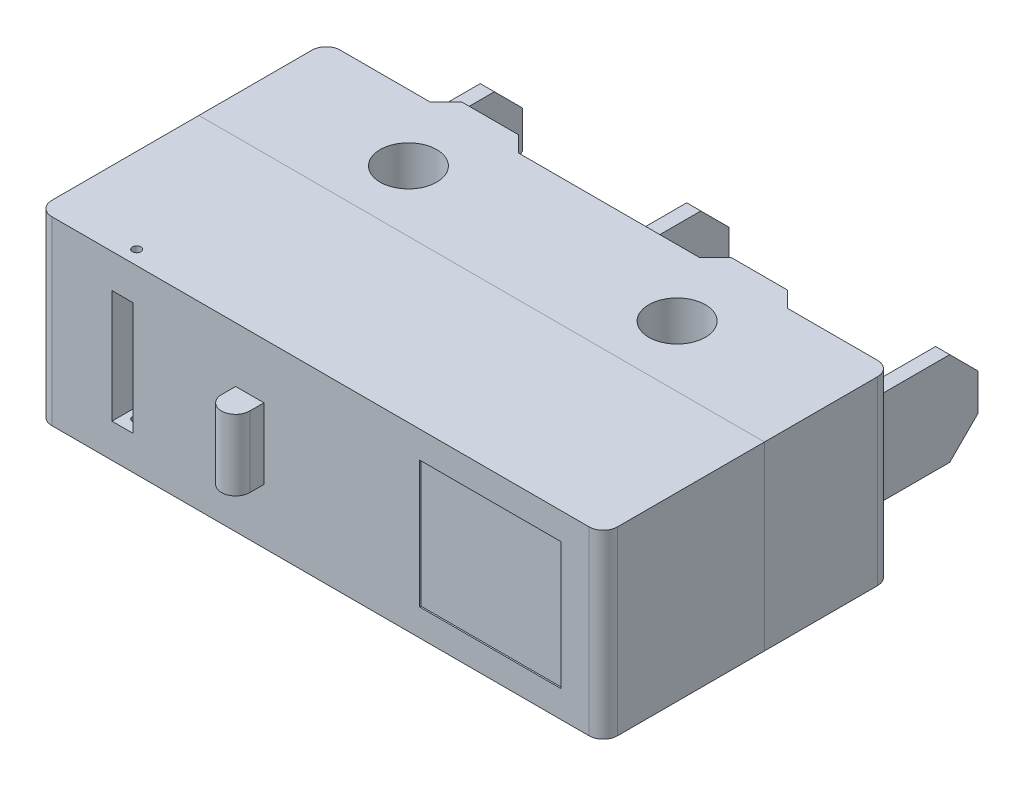
from build123d import *

# Parameters (mm, degrees)
BASE_SKETCH_W               = 20
BASE_SKETCH_H               = 6.4
BASE_EXTRUDE_DEPTH          = 4.5
CONTACTS_SKETCH_W           = 0.5
CONTACTS_SKETCH_H           = 3.3
CONTACTS_EXTRUDE_DEPTH      = 4
CONTACTS_EXTRUDE_2_DEPTH    = 4
CONTACTS_EXTRUDE_3_DEPTH    = 4
CONTACT_1_CHAMFER_SIZE      = 1
CHAMFER1_SIZE               = 1
CHAMFER2_SIZE               = 1
MOUNTING_HOLES_SKETCH_R     = 1
CUT_MOUNTING_HOLES_DEPTH    = 6.4
BOTTOM_PROTRUSIONS_SKETCH_W = 2
BOTTOM_PROTRUSIONS_SKETCH_H = 0.56
BOTTOM_PROTRUSIONS_DEPTH    = 6.4
CHAMFER_PROTRUSIONS_SIZE    = 0.56
TOP_SKETCH_W                = 20.0002
TOP_SKETCH_H                = 6.4002
TOP_EXTRUDE_DEPTH           = 5.7
BUTTON_SKETCH_W             = 1
BUTTON_SKETCH_H             = 2.5
BUTTON_EXTRUDE_DEPTH        = 1
BUTTON_FILLET_RADIUS        = 0.5
BUTTON_FILLET_LENGTH        = 2.5
TOP_INDENT_SKETCH_W         = 5
TOP_INDENT_SKETCH_H         = 4.5
TOP_INDENT_CUT_DEPTH        = 0.05
PIVOT_HOLE_SKETCH_R         = 0.15
LEVER_PIVOT_HOLE_CUT_DEPTH  = 10
LEVER_RECESS_SKETCH_W       = 0.75
LEVER_RECESS_SKETCH_H       = 4
LEVER_RECESS_CUT_DEPTH      = 1.2
CORNER_FILLET_R             = 0.5


with BuildPart() as part:
    # Base Sketch → Base Extrude (new body)
    with BuildSketch(Plane.XY):
        Rectangle(BASE_SKETCH_W, BASE_SKETCH_H)
    extrude(amount=BASE_EXTRUDE_DEPTH)

    # Mounting Holes Sketch → Cut Mounting Holes (cut)
    with BuildSketch(Plane(origin=(0, 3.2, 0), x_dir=(1, 0, 0), z_dir=(0, 1, 0))):
        with Locations(Location((-4.75, -2.34, 0), (0, 0, 270))):
            Circle(MOUNTING_HOLES_SKETCH_R)
        with Locations(Location((4.75, -2.34, 0), (0, 0, 270))):
            Circle(MOUNTING_HOLES_SKETCH_R)
    extrude(amount=-CUT_MOUNTING_HOLES_DEPTH, mode=Mode.SUBTRACT)

    # Bottom Protrusions Sketch → Bottom Protrusions (add)
    with BuildSketch(Plane(origin=(0, 3.2, 0), x_dir=(1, 0, 0), z_dir=(0, 1, 0))):
        with Locations((-4.75, 0.28)):
            Rectangle(BOTTOM_PROTRUSIONS_SKETCH_W, BOTTOM_PROTRUSIONS_SKETCH_H)
        with Locations((4.75, 0.28)):
            Rectangle(BOTTOM_PROTRUSIONS_SKETCH_W, BOTTOM_PROTRUSIONS_SKETCH_H)
    extrude(amount=-BOTTOM_PROTRUSIONS_DEPTH)

    # Chamfer Protrusions
    chamfer_protrusions_edges = [part.edges().sort_by_distance(p)[0] for p in [
        (5.75, 0, 0),
        (3.75, 0, 0),
        (-3.75, 0, 0),
        (-5.75, 0, 0),
    ]]
    chamfer(chamfer_protrusions_edges, length=CHAMFER_PROTRUSIONS_SIZE - 0.0001)  # a hair under: the kernel refuses the full size

    # Top Sketch → Top Extrude (add)
    with BuildSketch(Plane.XY.offset(4.5)):
        Rectangle(TOP_SKETCH_W, TOP_SKETCH_H)
    extrude(amount=TOP_EXTRUDE_DEPTH)

    # Top Indent Sketch → Top Indent Cut (cut)
    with BuildSketch(Plane.XY.offset(10.2)):
        with Locations((6.0001, 0)):
            Rectangle(TOP_INDENT_SKETCH_W, TOP_INDENT_SKETCH_H)
    extrude(amount=-TOP_INDENT_CUT_DEPTH, mode=Mode.SUBTRACT)

    # Pivot Hole Sketch → Lever Pivot Hole Cut (cut)
    with BuildSketch(Plane(origin=(0, 3.2001, 0), x_dir=(1, 0, 0), z_dir=(0, 1, 0))):
        with Locations(Location((-7.000095614, -9.7, 0), (0, 0, 270))):
            Circle(PIVOT_HOLE_SKETCH_R)
    extrude(amount=-LEVER_PIVOT_HOLE_CUT_DEPTH, mode=Mode.SUBTRACT)

    # Lever Recess Sketch → Lever Recess Cut (cut)
    with BuildSketch(Plane.XY.offset(10.2)):
        with Locations((-7.0001, 0)):
            Rectangle(LEVER_RECESS_SKETCH_W, LEVER_RECESS_SKETCH_H)
    extrude(amount=-LEVER_RECESS_CUT_DEPTH, mode=Mode.SUBTRACT)

    # Corner Fillet
    corner_fillet_edges = [part.edges().sort_by_distance(p)[0] for p in [
        (10.0001, 0, 10.2),
        (-10.0001, 0, 10.2),
        (-10, 0, 0),
        (10, 0, 0),
    ]]
    fillet(corner_fillet_edges, radius=CORNER_FILLET_R)


with BuildPart() as body_2:
    # Contacts Sketch → Contacts Extrude (new body)
    with BuildSketch(Plane(origin=(0, 0, 0), x_dir=(-1, 0, 0), z_dir=(0, 0, -1))):
        Rectangle(CONTACTS_SKETCH_W, CONTACTS_SKETCH_H)
    extrude(amount=CONTACTS_EXTRUDE_DEPTH)

    # Chamfer1
    chamfer1_edges = [body_2.edges().sort_by_distance(p)[0] for p in [
        (0, -1.65, -4),
        (0, 1.65, -4),
    ]]
    chamfer(chamfer1_edges, length=CHAMFER1_SIZE)


with BuildPart() as body_3:
    # Contacts Sketch → Contacts Extrude 2 (new body)
    with BuildSketch(Plane(origin=(0, 0, 0), x_dir=(-1, 0, 0), z_dir=(0, 0, -1))):
        with Locations((-8.8, 0)):
            Rectangle(CONTACTS_SKETCH_W, CONTACTS_SKETCH_H)
    extrude(amount=CONTACTS_EXTRUDE_2_DEPTH)

    # Chamfer2
    chamfer2_edges = [body_3.edges().sort_by_distance(p)[0] for p in [
        (8.8, -1.65, -4),
        (8.8, 1.65, -4),
    ]]
    chamfer(chamfer2_edges, length=CHAMFER2_SIZE)


with BuildPart() as body_4:
    # Contacts Sketch → Contacts Extrude 3 (new body)
    with BuildSketch(Plane(origin=(0, 0, 0), x_dir=(-1, 0, 0), z_dir=(0, 0, -1))):
        with Locations((7.3, 0)):
            Rectangle(CONTACTS_SKETCH_W, CONTACTS_SKETCH_H)
    extrude(amount=CONTACTS_EXTRUDE_3_DEPTH)

    # Contact 1 Chamfer
    contact_1_chamfer_edges = [body_4.edges().sort_by_distance(p)[0] for p in [
        (-7.3, -1.65, -4),
        (-7.3, 1.65, -4),
    ]]
    chamfer(contact_1_chamfer_edges, length=CONTACT_1_CHAMFER_SIZE)


with BuildPart() as body_5:
    # Button Sketch → Button Extrude (new body)
    with BuildSketch(Plane.XY.offset(10.2)):
        with Locations((-2.5001, 0)):
            Rectangle(BUTTON_SKETCH_W, BUTTON_SKETCH_H)
    extrude(amount=BUTTON_EXTRUDE_DEPTH)

    # Button Fillet: full round fillet: the end face becomes a half cylinder, R = half its width
    button_fillet_face = Plane((-2.5001, 0, 11.2), x_dir=(0, 1, 0), z_dir=(0, 0, 1))  # on the end face: x along it, z out of the body
    button_fillet_slab = button_fillet_face.offset(-BUTTON_FILLET_RADIUS / 2) * Box(BUTTON_FILLET_LENGTH, 2 * BUTTON_FILLET_RADIUS, BUTTON_FILLET_RADIUS, mode=Mode.PRIVATE)  # the body's end, R deep
    button_fillet_round = Plane((-2.5001, 0, 10.7), x_dir=(0, 0, 1), z_dir=(0, 1, 0)) * Cylinder(BUTTON_FILLET_RADIUS, BUTTON_FILLET_LENGTH, mode=Mode.PRIVATE)  # its axis R under the face
    add(button_fillet_slab - button_fillet_round, mode=Mode.SUBTRACT)


solid = Compound([part.part, body_2.part, body_3.part, body_4.part, body_5.part])
